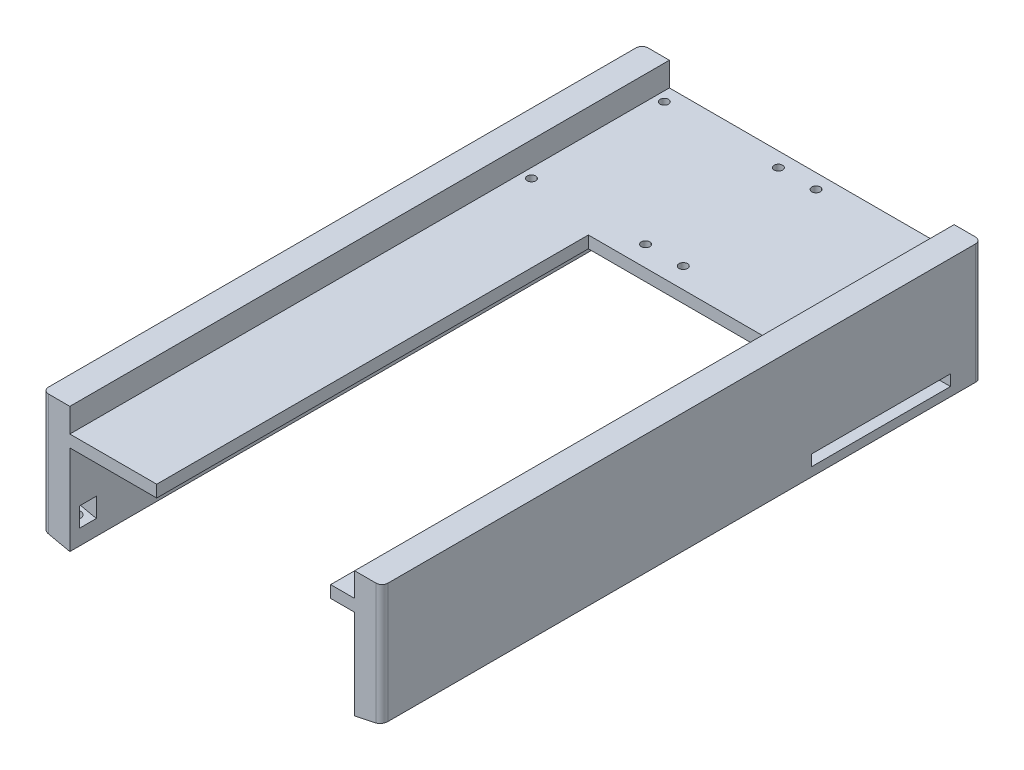
from build123d import *

# Parameters (mm, degrees)
BOSS_EXTRUDE1_DEPTH = 317.5
FILLET1_R           = 3.175
CUT_EXTRUDE4_REACH  = 336.362
SKETCH2_W           = 92.1125
SKETCH2_H           = 228.6
CUT_EXTRUDE3_REACH  = 336.362
SKETCH7_R           = 2.25
CUT_EXTRUDE6_REACH  = 372.916
SKETCH9_W           = 73.74
SKETCH9_H           = 5.842
SKETCH13_R          = 2.38125
CUT_EXTRUDE10_DEPTH = 10
SKETCH14_R          = 2.38125
CUT_EXTRUDE11_DEPTH = 10
CUT_EXTRUDE12_START = -8
CUT_EXTRUDE12_DEPTH = 10
CUT_EXTRUDE13_START = -8
CUT_EXTRUDE13_DEPTH = 10


with BuildPart() as part:
    # Sketch1 → Boss-Extrude1 (new body)
    with BuildSketch(Plane.XY):
        Polygon((-75.40625, 0), (-89.90625, 3.13), (-89.90625, 66.63), (-75.40625, 66.63), (-75.40625, 53.93), (75.40625, 53.93), (75.40625, 66.63), (89.90625, 66.63), (89.90625, 3.13), (75.40625, 0), (75.40625, 4.7625), (75.40625, 47.58), (-75.40625, 47.58), (-75.40625, 4.7625), align=None)
    extrude(amount=BOSS_EXTRUDE1_DEPTH)

    # Fillet1
    fillet1_edges = [part.edges().sort_by_distance(p)[0] for p in [
        (89.90625, 34.88, 0),
        (-89.90625, 34.88, 0),
        (89.90625, 34.88, 317.5),
        (-89.90625, 34.88, 317.5),
    ]]
    fillet(fillet1_edges, radius=FILLET1_R)

    # Sketch2 → Cut-Extrude4 (cut, up to next)
    with BuildSketch(Plane(origin=(0, 53.93, 0), x_dir=(1, 0, 0), z_dir=(0, 1, 0)), mode=Mode.PRIVATE) as cut_extrude4_sk1:
        with Locations((16.65, -203.2)):
            Rectangle(SKETCH2_W, SKETCH2_H)
    cut_extrude4_tool1 = extrude(cut_extrude4_sk1.sketch, amount=-CUT_EXTRUDE4_REACH, mode=Mode.PRIVATE) & part.part
    add(cut_extrude4_tool1.solids().sort_by_distance((16.65, 53.93, 203.2))[0], mode=Mode.SUBTRACT)

    # Sketch7 → Cut-Extrude3 (cut, up to next)
    with BuildSketch(Plane(origin=(0, 53.93, 0), x_dir=(1, 0, 0), z_dir=(0, 1, 0)), mode=Mode.PRIVATE) as cut_extrude3_sk1:
        with Locations((-70.40625, -7.7)):
            Circle(SKETCH7_R)
    cut_extrude3_tool1 = extrude(cut_extrude3_sk1.sketch, amount=-CUT_EXTRUDE3_REACH, mode=Mode.PRIVATE) & part.part
    # Sketch7 → Cut-Extrude3 (cut, up to next)
    with BuildSketch(Plane(origin=(0, 53.93, 0), x_dir=(1, 0, 0), z_dir=(0, 1, 0)), mode=Mode.PRIVATE) as cut_extrude3_sk2:
        with Locations((-9.97925, -7.7)):
            Circle(SKETCH7_R)
    cut_extrude3_tool2 = extrude(cut_extrude3_sk2.sketch, amount=-CUT_EXTRUDE3_REACH, mode=Mode.PRIVATE) & part.part
    # Sketch7 → Cut-Extrude3 (cut, up to next)
    with BuildSketch(Plane(origin=(0, 53.93, 0), x_dir=(1, 0, 0), z_dir=(0, 1, 0)), mode=Mode.PRIVATE) as cut_extrude3_sk3:
        with Locations((9.97925, -7.7)):
            Circle(SKETCH7_R)
    cut_extrude3_tool3 = extrude(cut_extrude3_sk3.sketch, amount=-CUT_EXTRUDE3_REACH, mode=Mode.PRIVATE) & part.part
    # Sketch7 → Cut-Extrude3 (cut, up to next)
    with BuildSketch(Plane(origin=(0, 53.93, 0), x_dir=(1, 0, 0), z_dir=(0, 1, 0)), mode=Mode.PRIVATE) as cut_extrude3_sk4:
        with Locations((70.40625, -7.7)):
            Circle(SKETCH7_R)
    cut_extrude3_tool4 = extrude(cut_extrude3_sk4.sketch, amount=-CUT_EXTRUDE3_REACH, mode=Mode.PRIVATE) & part.part
    # Sketch7 → Cut-Extrude3 (cut, up to next)
    with BuildSketch(Plane(origin=(0, 53.93, 0), x_dir=(1, 0, 0), z_dir=(0, 1, 0)), mode=Mode.PRIVATE) as cut_extrude3_sk5:
        with Locations((-70.40625, -78.025)):
            Circle(SKETCH7_R)
    cut_extrude3_tool5 = extrude(cut_extrude3_sk5.sketch, amount=-CUT_EXTRUDE3_REACH, mode=Mode.PRIVATE) & part.part
    # Sketch7 → Cut-Extrude3 (cut, up to next)
    with BuildSketch(Plane(origin=(0, 53.93, 0), x_dir=(1, 0, 0), z_dir=(0, 1, 0)), mode=Mode.PRIVATE) as cut_extrude3_sk6:
        with Locations((-9.97925, -78.025)):
            Circle(SKETCH7_R)
    cut_extrude3_tool6 = extrude(cut_extrude3_sk6.sketch, amount=-CUT_EXTRUDE3_REACH, mode=Mode.PRIVATE) & part.part
    # Sketch7 → Cut-Extrude3 (cut, up to next)
    with BuildSketch(Plane(origin=(0, 53.93, 0), x_dir=(1, 0, 0), z_dir=(0, 1, 0)), mode=Mode.PRIVATE) as cut_extrude3_sk7:
        with Locations((9.97925, -78.025)):
            Circle(SKETCH7_R)
    cut_extrude3_tool7 = extrude(cut_extrude3_sk7.sketch, amount=-CUT_EXTRUDE3_REACH, mode=Mode.PRIVATE) & part.part
    # Sketch7 → Cut-Extrude3 (cut, up to next)
    with BuildSketch(Plane(origin=(0, 53.93, 0), x_dir=(1, 0, 0), z_dir=(0, 1, 0)), mode=Mode.PRIVATE) as cut_extrude3_sk8:
        with Locations((70.40625, -78.025)):
            Circle(SKETCH7_R)
    cut_extrude3_tool8 = extrude(cut_extrude3_sk8.sketch, amount=-CUT_EXTRUDE3_REACH, mode=Mode.PRIVATE) & part.part
    add(cut_extrude3_tool1.solids().sort_by_distance((-70.40625, 53.93, 7.7))[0], mode=Mode.SUBTRACT)
    add(cut_extrude3_tool2.solids().sort_by_distance((-9.97925, 53.93, 7.7))[0], mode=Mode.SUBTRACT)
    add(cut_extrude3_tool3.solids().sort_by_distance((9.97925, 53.93, 7.7))[0], mode=Mode.SUBTRACT)
    add(cut_extrude3_tool4.solids().sort_by_distance((70.40625, 53.93, 7.7))[0], mode=Mode.SUBTRACT)
    add(cut_extrude3_tool5.solids().sort_by_distance((-70.40625, 53.93, 78.025))[0], mode=Mode.SUBTRACT)
    add(cut_extrude3_tool6.solids().sort_by_distance((-9.97925, 53.93, 78.025))[0], mode=Mode.SUBTRACT)
    add(cut_extrude3_tool7.solids().sort_by_distance((9.97925, 53.93, 78.025))[0], mode=Mode.SUBTRACT)
    add(cut_extrude3_tool8.solids().sort_by_distance((70.40625, 53.93, 78.025))[0], mode=Mode.SUBTRACT)

    # Sketch9 → Cut-Extrude6 (cut, up to next)
    with BuildSketch(Plane(origin=(89.90625, 0, 0), x_dir=(0, 0, -1), z_dir=(1, 0, 0)), mode=Mode.PRIVATE) as cut_extrude6_sk1:
        with Locations((-53.3, 10.763)):
            Rectangle(SKETCH9_W, SKETCH9_H)
    cut_extrude6_tool1 = extrude(cut_extrude6_sk1.sketch, amount=-CUT_EXTRUDE6_REACH, mode=Mode.PRIVATE) & part.part
    cut_extrude6 = cut_extrude6_tool1.solids().sort_by_distance((89.90625, 10.763, 53.3))[0]
    add(cut_extrude6, mode=Mode.SUBTRACT)

    # Mirror1: Cut-Extrude6 across plane
    add(cut_extrude6.mirror(Plane(origin=(0, 0, 0), x_dir=(0, 0, 1), z_dir=(1, 0, 0))), mode=Mode.SUBTRACT)

    # Sketch13 → Cut-Extrude10 (cut)
    with BuildSketch(Plane(origin=(-3.357227439, -15.552651077, 0), x_dir=(0.9774856150436892, -0.2110020672473631, 0), z_dir=(-0.2110020672473631, -0.9774856150436892, 0))):
        with Locations((-81.435865286, 307.975)):
            Circle(SKETCH13_R)
        with Locations((-81.435865286, 207.9625)):
            Circle(SKETCH13_R)
        with Locations((-81.435865286, 107.95)):
            Circle(SKETCH13_R)
        with Locations((-81.435865286, 7.9375)):
            Circle(SKETCH13_R)
    extrude(amount=-CUT_EXTRUDE10_DEPTH, mode=Mode.SUBTRACT)

    # Sketch14 → Cut-Extrude11 (cut)
    with BuildSketch(Plane(origin=(3.357227439, -15.552651077, 0), x_dir=(0.9774856150436898, 0.21100206724736004, 0), z_dir=(0.21100206724736004, -0.9774856150436898, 0))):
        with Locations((81.125513604, 307.975)):
            Circle(SKETCH14_R)
        with Locations((81.125513604, 195.2625)):
            Circle(SKETCH14_R)
        with Locations((81.125513604, 107.95)):
            Circle(SKETCH14_R)
        with Locations((81.125513604, 7.9375)):
            Circle(SKETCH14_R)
    extrude(amount=-CUT_EXTRUDE11_DEPTH, mode=Mode.SUBTRACT)

    # Sketch15 → Cut-Extrude12 (cut)
    with BuildSketch(Plane(origin=(-3.357227439, -15.552651077, 0), x_dir=(0.9774856150436892, -0.2110020672473631, 0), z_dir=(-0.2110020672473631, -0.9774856150436892, 0)).offset(CUT_EXTRUDE12_START)):
        Polygon((-73.708524659, 307.975), (-73.708524659, 312.475), (-85.935865286, 312.475), (-85.935865286, 303.475), (-73.708524659, 303.475), align=None)
        Polygon((-73.708524659, 207.9625), (-73.708524659, 212.4625), (-85.935865286, 212.4625), (-85.935865286, 203.4625), (-73.708524659, 203.4625), align=None)
        Polygon((-73.708524659, 107.95), (-73.708524659, 112.45), (-85.935865286, 112.45), (-85.935865286, 103.45), (-73.708524659, 103.45), align=None)
        Polygon((-73.708524659, 7.9375), (-73.708524659, 12.4375), (-85.935865286, 12.4375), (-85.935865286, 3.4375), (-73.708524659, 3.4375), align=None)
    extrude(amount=-CUT_EXTRUDE12_DEPTH, mode=Mode.SUBTRACT)

    # Sketch16 → Cut-Extrude13 (cut)
    with BuildSketch(Plane(origin=(3.357227439, -15.552651077, 0), x_dir=(0.9774856150436898, 0.21100206724736004, 0), z_dir=(0.21100206724736004, -0.9774856150436898, 0)).offset(CUT_EXTRUDE13_START)):
        Polygon((85.625513604, 307.975), (85.625513604, 312.475), (73.708524659, 312.475), (73.708524659, 303.475), (85.625513604, 303.475), align=None)
        Polygon((85.625513604, 195.2625), (85.625513604, 199.7625), (73.708524659, 199.7625), (73.708524659, 190.7625), (85.625513604, 190.7625), align=None)
        Polygon((85.625513604, 107.95), (85.625513604, 112.45), (73.708524659, 112.45), (73.708524659, 103.45), (85.625513604, 103.45), align=None)
        Polygon((85.625513604, 7.9375), (85.625513604, 12.4375), (73.708524659, 12.4375), (73.708524659, 3.4375), (85.625513604, 3.4375), align=None)
    extrude(amount=-CUT_EXTRUDE13_DEPTH, mode=Mode.SUBTRACT)


solid = part.part
